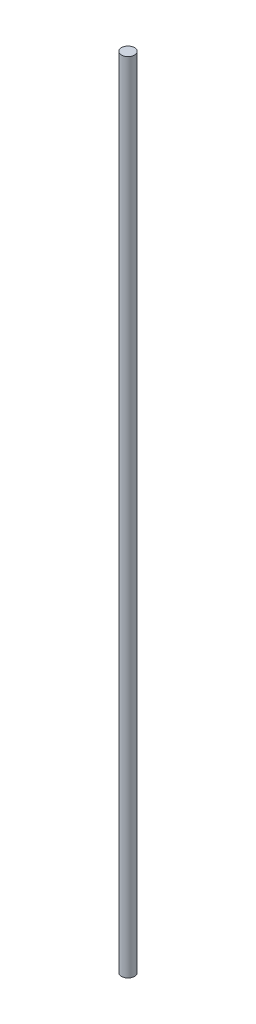
from build123d import *

# Parameters (mm, degrees)
CROQUIS5_R              = 3
SALIENTE_EXTRUIR3_DEPTH = 184


with BuildPart() as part:
    # Croquis5 → Saliente-Extruir3 (new, symmetric)
    with BuildSketch(Plane(origin=(0, 0, 0), x_dir=(1, 0, 0), z_dir=(0, 1, 0))):
        Circle(CROQUIS5_R)
    extrude(amount=SALIENTE_EXTRUIR3_DEPTH, both=True)


solid = part.part
